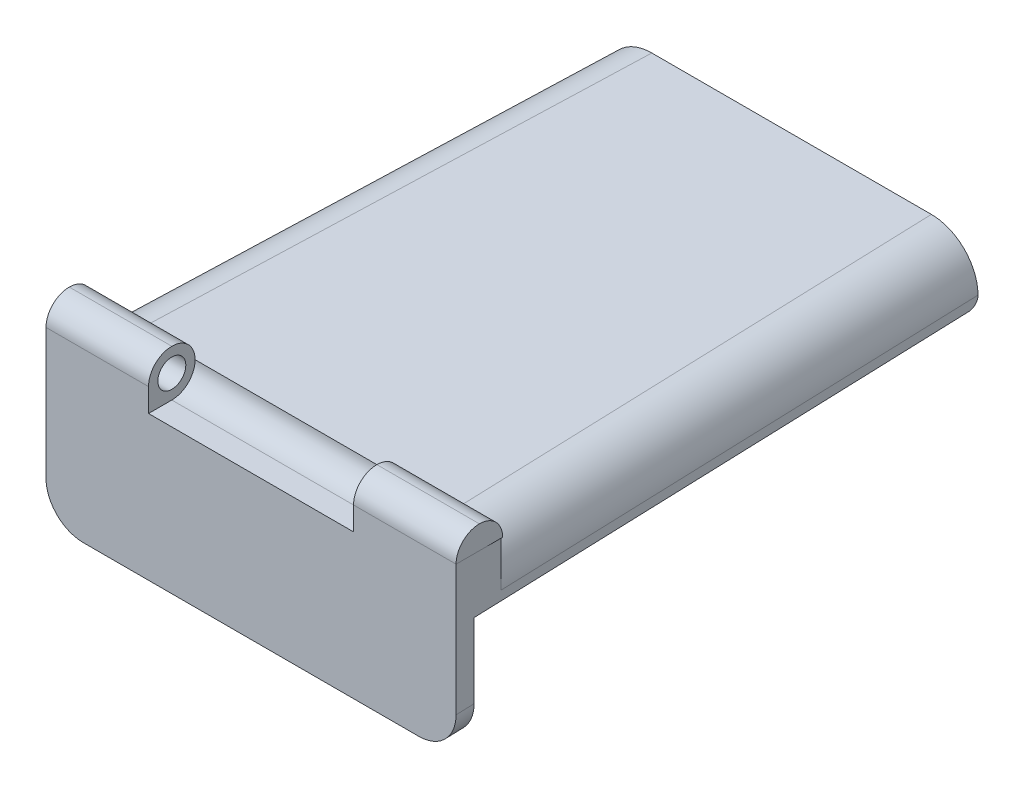
from build123d import *

# Parameters (mm, degrees)
EXTRUDE_1_DEPTH     = 22
EXTRUDE_2_DEPTH     = 21
CUT_EXTRUDE_1_REACH = 66.591
CUT_EXTRUDE_2_DEPTH = 11
FILLET_2_R          = 3
FILLET_3_R          = 4
SKETCH_6_W          = 11
SKETCH_6_H          = 2.5
EXTRUDE_6_DEPTH     = 5
FILLET_4_R          = 5
FILLET_5_R          = 2.5
SKETCH_7_R          = 1.5
CUT_EXTRUDE_3_DEPTH = 16
CUT_EXTRUDE_4_DEPTH = 11
CUT_EXTRUDE_5_DEPTH = 0.5
FILLET_7_R          = 1.5
FILLET_8_R          = 1
SKETCH_10_R         = 4.5
EXTRUDE_7_DEPTH     = 8
SKETCH_11_R         = 1.5
CUT_EXTRUDE_6_DEPTH = 3
CUT_EXTRUDE_START   = -3
SKETCH_12_R         = 1.5
CUT_EXTRUDE_7_DEPTH = 3


with BuildPart() as part:
    # Эскиз1 → Бобышка-Вытянуть1 (new, symmetric)
    with BuildSketch(Plane(origin=(0, 0, 0), x_dir=(0, 0, -1), z_dir=(1, 0, 0))):
        Polygon((0, -18), (0, 0), (58, 0), (58, -6), (2, -6), (2, -18), align=None)
    extrude(amount=EXTRUDE_1_DEPTH, both=True)

    # Эскиз2 → Бобышка-Вытянуть2 (add, symmetric)
    with BuildSketch(Plane(origin=(0, 0, 0), x_dir=(0, 0, -1), z_dir=(1, 0, 0))):
        Polygon((2, -6), (48, -6), (48, -7), (3, -7), (3, -17), (2, -17), align=None)
    extrude(amount=EXTRUDE_2_DEPTH, both=True)

    # Вырез-Вытянуть1: up to this face of the body (flat: up to its plane)
    cut_extrude_1_end = Plane(part.part.faces().sort_by_distance((0, -18, -1))[0])
    # Эскиз3 → Вырез-Вытянуть1 (cut, up to the picked face)
    with BuildSketch(Plane(origin=(0, 0, 0), x_dir=(1, 0, 0), z_dir=(0, 1, 0)), mode=Mode.PRIVATE) as cut_extrude_1_sk1:
        Polygon((-20, 58), (-22, 58), (-22, 0), align=None)
    cut_extrude_1_tool1 = split(extrude(cut_extrude_1_sk1.sketch, amount=-CUT_EXTRUDE_1_REACH, mode=Mode.PRIVATE), bisect_by=cut_extrude_1_end, keep=Keep.BOTH, mode=Mode.PRIVATE)
    # Эскиз3 → Вырез-Вытянуть1 (cut, up to the picked face)
    with BuildSketch(Plane(origin=(0, 0, 0), x_dir=(1, 0, 0), z_dir=(0, 1, 0)), mode=Mode.PRIVATE) as cut_extrude_1_sk2:
        Polygon((22, 58), (22, 0), (20, 58), align=None)
    cut_extrude_1_tool2 = split(extrude(cut_extrude_1_sk2.sketch, amount=-CUT_EXTRUDE_1_REACH, mode=Mode.PRIVATE), bisect_by=cut_extrude_1_end, keep=Keep.BOTH, mode=Mode.PRIVATE)
    add(cut_extrude_1_tool1.solids().sort_by(Axis((-21.333333, 0, -38.666667), (0, -1, 0)))[0], mode=Mode.SUBTRACT)
    add(cut_extrude_1_tool2.solids().sort_by(Axis((21.333333, 0, -38.666667), (0, -1, 0)))[0], mode=Mode.SUBTRACT)

    # Эскиз4 → Вырез-Вытянуть2 (cut)
    with BuildSketch(Plane.XZ.offset(6)):
        Polygon((-20.930440129, -2), (-19.344233233, -48), (-20.344827586, -48), (-21.931034483, -2), align=None)
        Polygon((19.344233233, -48), (20.344827586, -48), (21.931034483, -2), (20.930440129, -2), align=None)
    extrude(amount=CUT_EXTRUDE_2_DEPTH, mode=Mode.SUBTRACT)

    # Скругление2
    fillet_2_edges = [part.edges().sort_by_distance(p)[0] for p in [
        (19.344233233, -6.5, -48),
        (-19.344233233, -6.5, -48),
        (-20.91319875, -17, -2.5),
        (20.91319875, -17, -2.5),
    ]]
    fillet(fillet_2_edges, radius=FILLET_2_R)

    # Скругление3
    fillet_3_edges = [part.edges().sort_by_distance(p)[0] for p in [
        (-21.965517241, -18, -1),
        (21.965517241, -18, -1),
    ]]
    fillet(fillet_3_edges, radius=FILLET_3_R)

    # Эскиз6 → Бобышка-Вытянуть6 (add)
    with BuildSketch(Plane.XY):
        with Locations((-16.5, 1.25)):
            Rectangle(SKETCH_6_W, SKETCH_6_H)
        with Locations((16.5, 1.25)):
            Rectangle(SKETCH_6_W, SKETCH_6_H)
    extrude(amount=-EXTRUDE_6_DEPTH)

    # Скругление4
    fillet_4_edges = [part.edges().sort_by_distance(p)[0] for p in [
        (-20.913793103, 0, -31.5),
        (20.913793103, 0, -31.5),
    ]]
    fillet(fillet_4_edges, radius=FILLET_4_R)

    # Скругление5
    fillet_5_edges = [part.edges().sort_by_distance(p)[0] for p in [
        (-16.5, 2.5, -5),
        (-16.5, 2.5, 0),
        (16.5, 2.5, -5),
        (16.5, 2.5, 0),
    ]]
    fillet(fillet_5_edges, radius=FILLET_5_R - 0.0001)  # a hair under: the kernel refuses the full size

    # Эскиз7 → Вырез-Вытянуть3 (cut, symmetric)
    with BuildSketch(Plane(origin=(0, 0, 0), x_dir=(0, 0, -1), z_dir=(1, 0, 0))):
        with Locations((2.5, 0)):
            Circle(SKETCH_7_R)
    extrude(amount=CUT_EXTRUDE_3_DEPTH, both=True, mode=Mode.SUBTRACT)

    # Эскиз8 → Вырез-Вытянуть4 (cut, symmetric)
    with BuildSketch(Plane(origin=(0, 0, 0), x_dir=(0, 0, -1), z_dir=(1, 0, 0))):
        with BuildLine():
            Line((2.5, -2.5), (0, -2.5))
            Line((0, -2.5), (0, 0))
            ThreePointArc((0, 0), (4.267766953, 1.767766953), (2.5, -2.5))
        make_face()
    extrude(amount=CUT_EXTRUDE_4_DEPTH, both=True, mode=Mode.SUBTRACT)

    # Эскиз9 → Вырез-Вытянуть5 (cut)
    with BuildSketch(Plane(origin=(0, 0, -58), x_dir=(-1, 0, 0), z_dir=(0, 0, -1))):
        with BuildLine():
            Line((-14.997028232, -1), (14.997028232, -1))
            add(Edge.make_bspline(
                [(14.997028232, -1), (15.521093765, -1), (16.044951376, -1.104143211), (17.013235139, -1.504981238), (17.457278985, -1.801515154), (18.198254652, -2.542050681), (18.494897371, -2.985758471), (18.895847322, -3.953162299), (19, -4.476479025), (19, -5)],
                knots=[0, 0, 0, 0, 0.25, 0.25, 0.5, 0.5, 0.75, 0.75, 1, 1, 1, 1], degree=3))
            Line((19, -5), (19, -6))
            Line((19, -6), (-19, -6))
            Line((-19, -6), (-19, -5))
            add(Edge.make_bspline(
                [(-14.997028232, -1), (-15.521093765, -1), (-16.044951376, -1.104143211), (-17.013235139, -1.504981238), (-17.457278985, -1.801515154), (-18.198254652, -2.542050681), (-18.494897371, -2.985758471), (-18.895847322, -3.953162299), (-19, -4.476479025), (-19, -5)],
                knots=[0, 0, 0, 0, 0.25, 0.25, 0.5, 0.5, 0.75, 0.75, 1, 1, 1, 1], degree=3))
        make_face()
    extrude(amount=-CUT_EXTRUDE_5_DEPTH, mode=Mode.SUBTRACT)

    # Скругление7
    fillet_7_edges = [part.edges().sort_by_distance(p)[0] for p in [
        (0, -6, -57.5),
    ]]
    fillet(fillet_7_edges, radius=FILLET_7_R)

    # Скругление8
    fillet_8_edges = [part.edges().sort_by_distance(p)[0] for p in [
        (-19.5, -6, -58),
        (19.5, -6, -58),
    ]]
    fillet(fillet_8_edges, radius=FILLET_8_R)

    # Эскиз10 → Бобышка-Вытянуть7 (add, symmetric)
    with BuildSketch(Plane(origin=(0, 0, 0), x_dir=(0, 0, -1), z_dir=(1, 0, 0))):
        with Locations((58, -7)):
            Circle(SKETCH_10_R)
    extrude(amount=EXTRUDE_7_DEPTH, both=True)

    # Эскиз11 → Вырез-Вытянуть6 (cut)
    with BuildSketch(Plane(origin=(8, 0, 0), x_dir=(0, 0, -1), z_dir=(1, 0, 0))):
        with Locations((58, -7)):
            Circle(SKETCH_11_R)
    extrude(amount=-CUT_EXTRUDE_6_DEPTH, mode=Mode.SUBTRACT)

    # Эскиз12 → Вырез-Вытянуть7 (cut)
    with BuildSketch(Plane.ZY.offset(8).offset(CUT_EXTRUDE_START)):
        with Locations(Location((-58, -7, 0), (0, 0, 180))):
            Circle(SKETCH_12_R)
    extrude(amount=CUT_EXTRUDE_7_DEPTH, mode=Mode.SUBTRACT)

    # Эскиз13 → Вырез-Повернуть1 (revolve, cut)
    with BuildSketch(Plane(origin=(0, -7, 0), x_dir=(-1, 0, 0), z_dir=(0, 1, 0)), mode=Mode.PRIVATE) as cut_revolve_1_sk:
        with BuildLine():
            Line((-14.5, -58), (-8, -58))
            Line((-8, -58), (-8, -62.5))
            Line((-8, -62.5), (-10, -62.5))
            ThreePointArc((-10, -62.5), (-13.181980515, -61.181980515), (-14.5, -58))
        make_face()
        with BuildLine():
            Line((8, -58), (8, -62.5))
            Line((8, -62.5), (10, -62.5))
            ThreePointArc((10, -62.5), (13.181980515, -61.181980515), (14.5, -58))
            Line((14.5, -58), (8, -58))
        make_face()
    revolve(cut_revolve_1_sk.sketch.rotate(Axis((21.094367923, -7, -58), (-1, 0, 0)), 180), axis=Axis((21.094367923, -7, -58), (-1, 0, 0)), mode=Mode.SUBTRACT)


solid = part.part
